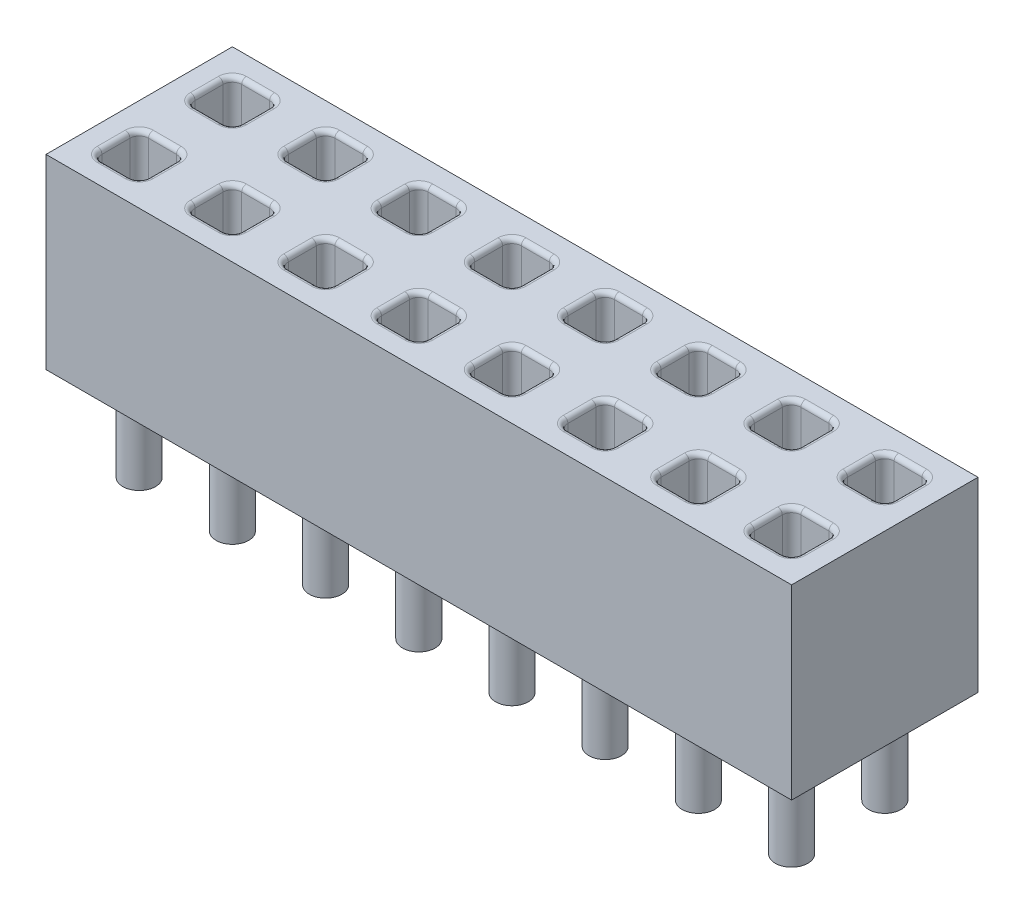
from build123d import *

# Parameters (mm, degrees)
SKETCH_1_W                  = 2
SKETCH_1_H                  = 2
EXTRUDE_1_DEPTH             = 4
CUT_EXTRUDE_1_DEPTH         = 3
SKETCH_3_R                  = 0.35
EXTRUDE_2_DEPTH             = 2
PATTERN_LINEAR_1_COUNT      = 8
PATTERN_LINEAR_1_PITCH      = 2
PATTERN_LINEAR_1_COUNT_DIR2 = 2
PATTERN_LINEAR_1_PITCH_DIR2 = 2
FILLET_1_R                  = 0.1


with BuildPart() as part:
    # 草图1 → 凸台-拉伸1 (new body)
    with BuildSketch(Plane(origin=(0, 0, 0), x_dir=(1, 0, 0), z_dir=(0, 1, 0))):
        with Locations((1, 1)):
            Rectangle(SKETCH_1_W, SKETCH_1_H)
    extrude_1 = extrude(amount=EXTRUDE_1_DEPTH)

    # 草图2 → 切除-拉伸1 (cut)
    with BuildSketch(Plane(origin=(0, 4, 0), x_dir=(1, 0, 0), z_dir=(0, 1, 0))):
        with BuildLine():
            Line((0.7, 0.5), (1.3, 0.5))
            ThreePointArc((1.3, 0.5), (1.441421356, 0.558578644), (1.5, 0.7))
            Line((1.5, 0.7), (1.5, 1.3))
            ThreePointArc((1.5, 1.3), (1.441421356, 1.441421356), (1.3, 1.5))
            Line((1.3, 1.5), (0.7, 1.5))
            ThreePointArc((0.7, 1.5), (0.558578644, 1.441421356), (0.5, 1.3))
            Line((0.5, 1.3), (0.5, 0.7))
            ThreePointArc((0.5, 0.7), (0.558578644, 0.558578644), (0.7, 0.5))
        make_face()
    cut_extrude_1 = extrude(amount=-CUT_EXTRUDE_1_DEPTH, mode=Mode.SUBTRACT)

    # 草图3 → 凸台-拉伸2 (add)
    with BuildSketch(Plane.XZ):
        with Locations((1, -1)):
            Circle(SKETCH_3_R)
    extrude_2 = extrude(amount=EXTRUDE_2_DEPTH)

    # 阵列(线性)1: 凸台-拉伸1, 切除-拉伸1, Extrude 2 8 × 2
    with Locations(*[(i * PATTERN_LINEAR_1_PITCH, 0, -j * PATTERN_LINEAR_1_PITCH_DIR2) for i in range(PATTERN_LINEAR_1_COUNT) for j in range(PATTERN_LINEAR_1_COUNT_DIR2) if (i, j) != (0, 0)]):
        add(extrude_1)
        add(cut_extrude_1, mode=Mode.SUBTRACT)
        add(extrude_2)

    # 圆角1
    fillet_1_edges = [part.edges().sort_by_distance(p)[0] for p in [
        (1.441421356, 4, -0.558578644),
        (1, 4, -0.5),
        (0.558578644, 4, -0.558578644),
        (0.5, 4, -1),
        (0.558578644, 4, -1.441421356),
        (1, 4, -1.5),
        (1.441421356, 4, -1.441421356),
        (1.5, 4, -1),
        (13.441421356, 4, -0.558578644),
        (13, 4, -0.5),
        (12.558578644, 4, -0.558578644),
        (12.5, 4, -1),
        (12.558578644, 4, -1.441421356),
        (13, 4, -1.5),
        (13.441421356, 4, -1.441421356),
        (14.558578644, 4, -0.558578644),
        (14.5, 4, -1),
        (14.558578644, 4, -1.441421356),
        (15, 4, -1.5),
        (15.441421356, 4, -1.441421356),
        (15.5, 4, -1),
        (15.441421356, 4, -0.558578644),
        (10.558578644, 4, -0.558578644),
        (10.5, 4, -1),
        (10.558578644, 4, -1.441421356),
        (11, 4, -1.5),
        (11.441421356, 4, -1.441421356),
        (11.5, 4, -1),
        (11.441421356, 4, -0.558578644),
        (14.558578644, 4, -2.558578644),
        (14.5, 4, -3),
        (14.558578644, 4, -3.441421356),
        (15, 4, -3.5),
        (15.441421356, 4, -3.441421356),
        (15.5, 4, -3),
        (15.441421356, 4, -2.558578644),
        (12.558578644, 4, -2.558578644),
        (12.5, 4, -3),
        (12.558578644, 4, -3.441421356),
        (13, 4, -3.5),
        (13.441421356, 4, -3.441421356),
        (13.5, 4, -3),
        (13.441421356, 4, -2.558578644),
        (10.558578644, 4, -2.558578644),
        (10.5, 4, -3),
        (10.558578644, 4, -3.441421356),
        (11, 4, -3.5),
        (11.441421356, 4, -3.441421356),
        (11.5, 4, -3),
        (11.441421356, 4, -2.558578644),
        (9.441421356, 4, -3.441421356),
        (9.5, 4, -3),
        (9.441421356, 4, -2.558578644),
        (9, 4, -2.5),
        (8.558578644, 4, -2.558578644),
        (8.5, 4, -3),
        (8.558578644, 4, -3.441421356),
        (9.441421356, 4, -1.441421356),
        (9.5, 4, -1),
        (9.441421356, 4, -0.558578644),
        (9, 4, -0.5),
        (8.558578644, 4, -0.558578644),
        (8.5, 4, -1),
        (8.558578644, 4, -1.441421356),
        (7.441421356, 4, -1.441421356),
        (7.5, 4, -1),
        (7.441421356, 4, -0.558578644),
        (7, 4, -0.5),
        (6.558578644, 4, -0.558578644),
        (6.5, 4, -1),
        (6.558578644, 4, -1.441421356),
        (6.558578644, 4, -2.558578644),
        (6.5, 4, -3),
        (6.558578644, 4, -3.441421356),
        (7, 4, -3.5),
        (7.441421356, 4, -3.441421356),
        (7.5, 4, -3),
        (7.441421356, 4, -2.558578644),
        (4.558578644, 4, -2.558578644),
        (4.5, 4, -3),
        (4.558578644, 4, -3.441421356),
        (5, 4, -3.5),
        (5.441421356, 4, -3.441421356),
        (5.5, 4, -3),
        (5.441421356, 4, -2.558578644),
        (4.558578644, 4, -0.558578644),
        (4.5, 4, -1),
        (4.558578644, 4, -1.441421356),
        (5, 4, -1.5),
        (5.441421356, 4, -1.441421356),
        (5.5, 4, -1),
        (5.441421356, 4, -0.558578644),
        (2.558578644, 4, -0.558578644),
        (2.5, 4, -1),
        (2.558578644, 4, -1.441421356),
        (3, 4, -1.5),
        (3.441421356, 4, -1.441421356),
        (3.5, 4, -1),
        (3.441421356, 4, -0.558578644),
        (2.558578644, 4, -3.441421356),
        (3, 4, -3.5),
        (3.441421356, 4, -3.441421356),
        (3.5, 4, -3),
        (3.441421356, 4, -2.558578644),
        (3, 4, -2.5),
        (2.558578644, 4, -2.558578644),
        (0.558578644, 4, -3.441421356),
        (1, 4, -3.5),
        (1.441421356, 4, -3.441421356),
        (1.5, 4, -3),
        (1.441421356, 4, -2.558578644),
        (1, 4, -2.5),
        (0.558578644, 4, -2.558578644),
        (13.5, 4, -1),
        (15, 4, -0.5),
        (11, 4, -0.5),
        (15, 4, -2.5),
        (13, 4, -2.5),
        (11, 4, -2.5),
        (9, 4, -3.5),
        (9, 4, -1.5),
        (7, 4, -1.5),
        (7, 4, -2.5),
        (5, 4, -2.5),
        (5, 4, -0.5),
        (3, 4, -0.5),
        (2.5, 4, -3),
        (0.5, 4, -3),
    ]]
    fillet(fillet_1_edges, radius=FILLET_1_R)


solid = part.part
